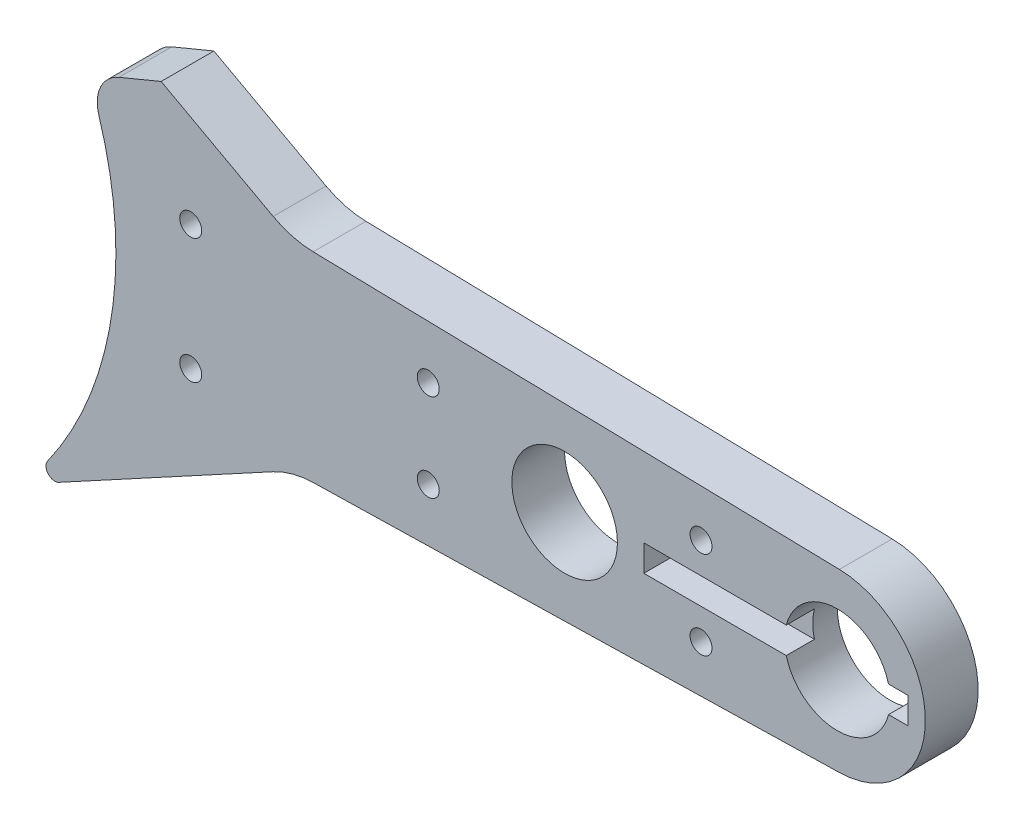
from build123d import *

# Parameters (mm, degrees)
SKETCH1_R                  = 14
SKETCH1_R_2                = 3
BOSS_EXTRUDE1_DEPTH        = 3
M1_6_CLEARANCE_HOLE2_D     = 1.8
M1_6_CLEARANCE_HOLE2_DEPTH = 11.5
CIRPATTERN1_COUNT          = 12
TROU_TARAUD_M1_61_D        = 1.25
CHAMFER2_SIZE              = 11.586303909
ESQUISSE1_R                = 21
ENL_V_MAT_EXTRU_1_DEPTH    = 10
ESQUISSE3_R                = 0.625
ENL_V_MAT_EXTRU_2_DEPTH    = 69.11418111
ESQUISSE5_W                = 15
ESQUISSE5_H                = 1.5
ENL_V_MAT_EXTRU_3_DEPTH    = 1.6
ENL_V_START                = -10
ENL_V_MAT_EXTRU_4_DEPTH    = 10
CONG_1_R                   = 2
BOSS_EXTRU_1_START         = -3
BOSS_EXTRU_1_DEPTH         = 3
CONG_2_R                   = 5
CONG_3_R                   = 0.5


with BuildPart() as part:
    # Sketch1 → Boss-Extrude1 (new body)
    with BuildSketch(Plane.XY):
        with BuildLine():
            Line((18.027756377, 6), (62.113532193, 4.998710878))
            ThreePointArc((62.113532193, 4.998710878), (67, 0), (62.113532193, -4.998710878))
            Line((62.113532193, -4.998710878), (18.027756377, -6))
            ThreePointArc((18.027756377, -6), (-19, 0), (18.027756377, 6))
        make_face()
        Circle(SKETCH1_R, mode=Mode.SUBTRACT)
        with Locations((46.5, 0)):
            Circle(SKETCH1_R_2, mode=Mode.SUBTRACT)
        with Locations((62, 0)):
            Circle(SKETCH1_R_2, mode=Mode.SUBTRACT)
    extrude(amount=BOSS_EXTRUDE1_DEPTH)

    # M1.6 Clearance Hole2
    with Locations(Plane.XY.offset(3)):
        with Locations((0, 16.5)):
            m1_6_clearance_hole2 = Hole(M1_6_CLEARANCE_HOLE2_D / 2, depth=M1_6_CLEARANCE_HOLE2_DEPTH)

    # CirPattern1: M1.6 Clearance Hole2 ×12 about axis
    cirpattern1_axis = Axis((0, 0, 0), (0, 0, 1))
    for i in range(1, CIRPATTERN1_COUNT):
        add(m1_6_clearance_hole2.rotate(cirpattern1_axis, i * 360 / CIRPATTERN1_COUNT), mode=Mode.SUBTRACT)

    # Trou taraudé M1.61 (through all)
    with Locations(Plane.XY.offset(3)):
        with Locations((38.75, 2.5), (54.25, -2.5), (38.75, -2.5), (54.25, 2.5)):
            Hole(TROU_TARAUD_M1_61_D / 2)

    # Chamfer2
    # the kernel refuses this chamfer: 11.586303909, 7 mm, written as the material it adds along each edge
    with BuildSketch(Plane(origin=(18.027756377, -6, 0), x_dir=(-0.5533672821308996, -0.8329373632315106, 0), z_dir=(0, 0, 1))) as chamfer2_piece_1:
        with BuildLine():
            Line((9.95669274, 0), (-CHAMFER2_SIZE * 0.572137651701, CHAMFER2_SIZE * 0.820157611387))
            Line((-CHAMFER2_SIZE * 0.572137651701, CHAMFER2_SIZE * 0.820157611387), (0, 0))
            ThreePointArc((0, 0), (5.187993151, 0.662647785), (9.95669274, 0))
        make_face()
    extrude(amount=3)
    with BuildSketch(Plane(origin=(18.027756377, 6, 0), x_dir=(0.9997421755844867, -0.02270643868151269, 0), z_dir=(0, 0, 1))) as chamfer2_piece_2:
        with BuildLine():
            Line((CHAMFER2_SIZE, 0), (-5.696598803, 8.166057335))
            ThreePointArc((-5.696598803, 8.166057335), (-2.424770594, 4.634097818), (0, 0))
            Line((0, 0), (CHAMFER2_SIZE, 0))
        make_face()
    extrude(amount=3)

    # Esquisse1 → Enlèv. mat.-Extru.1 (cut)
    with BuildSketch(Plane(origin=(0, 0, 0), x_dir=(-1, 0, 0), z_dir=(0, 0, -1))):
        Circle(ESQUISSE1_R)
    extrude(amount=-ENL_V_MAT_EXTRU_1_DEPTH, mode=Mode.SUBTRACT)

    # Esquisse3 → Enlèv. mat.-Extru.2 (cut, through all)
    with BuildSketch(Plane(origin=(0, 0, 0), x_dir=(-1, 0, 0), z_dir=(0, 0, -1))):
        with Locations((-25.251835753, 3.548914074)):
            Circle(ESQUISSE3_R)
        with Locations((-25.251835753, -3.548914074)):
            Circle(ESQUISSE3_R)
    extrude(amount=-ENL_V_MAT_EXTRU_2_DEPTH, mode=Mode.SUBTRACT)

    # Esquisse5 → Enlèv. mat.-Extru.3 (cut)
    with BuildSketch(Plane.XY.offset(3)):
        with Locations((58.5, 0)):
            Rectangle(ESQUISSE5_W, ESQUISSE5_H)
    extrude(amount=-ENL_V_MAT_EXTRU_3_DEPTH, mode=Mode.SUBTRACT)

    # Esquisse9 → Enlèv. mat.-Extru.4 (cut)
    with BuildSketch(Plane.XY.offset(3).offset(ENL_V_START)):
        with BuildLine():
            Line((22.5, 9.296560112), (19.409678401, 8.016506993))
            ThreePointArc((19.409678401, 8.016506993), (18.459529223, 10.012281501), (17.304864396, 11.897128572))
            Line((17.304864396, 11.897128572), (22.5, 9.296560112))
        make_face()
    extrude(amount=ENL_V_MAT_EXTRU_4_DEPTH, mode=Mode.SUBTRACT)

    # Congé1
    cong_1_edges = [part.edges().sort_by_distance(p)[0] for p in [
        (19.409678401, 8.016506993, 1.5),
    ]]
    fillet(cong_1_edges, radius=CONG_1_R)

    # Esquisse10 → Boss.-Extru.1 (add)
    with BuildSketch(Plane.XY.offset(3).offset(BOSS_EXTRU_1_START)):
        Polygon((31, 5.705370583), (23.569752194, 9.739665979), (22.5, 9.296560112), (29.611073054, 5.736916301), align=None)
        with BuildLine():
            Line((31, -5.705370583), (29.611073054, -5.736916301))
            Line((29.611073054, -5.736916301), (17.304864396, -11.897128572))
            ThreePointArc((17.304864396, -11.897128572), (16.480984157, -13.014498116), (15.585077408, -14.074990664))
            Line((15.585077408, -14.074990664), (31, -5.705370583))
        make_face()
    extrude(amount=BOSS_EXTRU_1_DEPTH)

    # Congé2
    cong_2_edges = [part.edges().sort_by_distance(p)[0] for p in [
        (31, 5.705370583, 1.5),
        (31, -5.705370583, 1.5),
    ]]
    fillet(cong_2_edges, radius=CONG_2_R)

    # Congé3
    cong_3_edges = [part.edges().sort_by_distance(p)[0] for p in [
        (15.585077408, -14.074990664, 1.5),
    ]]
    fillet(cong_3_edges, radius=CONG_3_R)


solid = part.part
